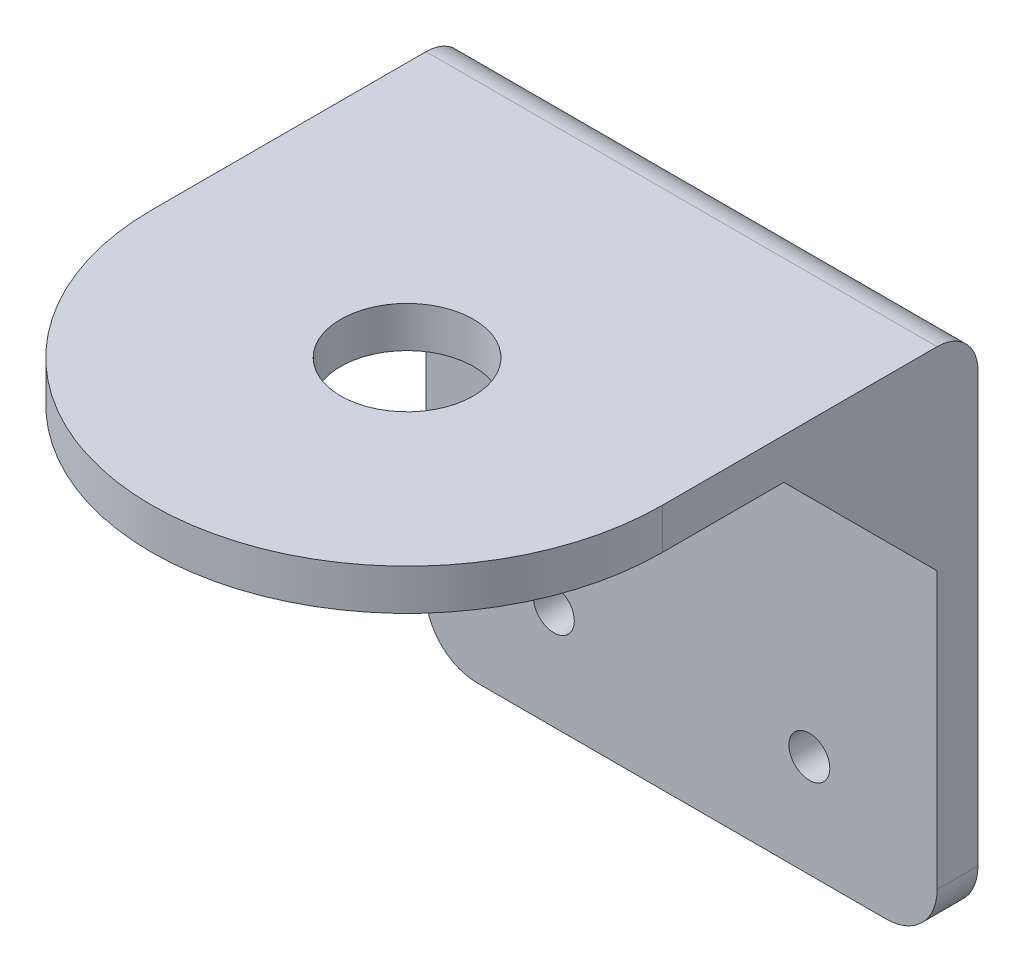
from build123d import *

# Parameters (mm, degrees)
SCHIZZO1_R                           = 6.5
SCHIZZO1_R_2                         = 2
BASE_FLANGIA1_DEPTH                  = 4
PIEGATURA_START                      = -26
PIEGATURA_DELLO_SCHIZZO1_OUTLINE_W   = 50
PIEGATURA_DELLO_SCHIZZO1_OUTLINE_H   = 4
PIEGATURA_DELLO_SCHIZZO1_DEPTH       = 52
PIEGATURA_START_2                    = -30
PIEGATURA_DELLO_SCHIZZO1_2_OUTLINE_R = 6.5
PIEGATURA_DELLO_SCHIZZO1_2_DEPTH     = 4
PIEGATURA_DELLO_SCHIZZO1_3_DEPTH     = 52
PIEGATURA_START_3                    = -25
PIEGATURA_DELLO_SCHIZZO1_4_DEPTH     = 50
ESTRUSIONE_ESTRUSIONE1_DEPTH         = 2


with BuildPart() as part:
    # Base-Flangia1: sheet metal written as solids
    # Schizzo1 → Base-Flangia1 (new body)
    with BuildSketch(Plane.XY):
        with BuildLine():
            Line((-25, -72), (-25, 0))
            ThreePointArc((-25, 0), (0, 25), (25, 0))
            Line((25, 0), (25, -72))
            ThreePointArc((25, -72), (23.535533906, -75.535533906), (20, -77))
            Line((20, -77), (-20, -77))
            ThreePointArc((-20, -77), (-23.535533906, -75.535533906), (-25, -72))
        make_face()
        Circle(SCHIZZO1_R, mode=Mode.SUBTRACT)
        with Locations((-12.5, -67)):
            Circle(SCHIZZO1_R_2, mode=Mode.SUBTRACT)
        with Locations((12.5, -67)):
            Circle(SCHIZZO1_R_2, mode=Mode.SUBTRACT)
    extrude(amount=-BASE_FLANGIA1_DEPTH)

    # Piegatura dello schizzo1: read off the stored shape, not the designer's step
    # Piegatura dello schizzo1 outline → Piegatura dello schizzo1 (cut)
    with BuildSketch(Plane(origin=(0, 0, 0), x_dir=(1, 0, 0), z_dir=(0, 1, 0)).offset(PIEGATURA_START)):
        with Locations((0, 2)):
            Rectangle(PIEGATURA_DELLO_SCHIZZO1_OUTLINE_W, PIEGATURA_DELLO_SCHIZZO1_OUTLINE_H)
    extrude(amount=PIEGATURA_DELLO_SCHIZZO1_DEPTH, mode=Mode.SUBTRACT)

    # Piegatura dello schizzo1 2 outline → Piegatura dello schizzo1 2 (add)
    with BuildSketch(Plane(origin=(0, 0, 0), x_dir=(1, 0, 0), z_dir=(0, 1, 0)).offset(PIEGATURA_START_2)):
        with BuildLine():
            Line((-25, 0), (-25, -26.862699383))
            ThreePointArc((-25, -26.862699383), (0, -51.862699383), (25, -26.862699383))
            Line((25, -26.862699383), (25, 0))
            Line((25, 0), (-25, 0))
        make_face()
        with Locations((0, -26.862699383)):
            Circle(PIEGATURA_DELLO_SCHIZZO1_2_OUTLINE_R, mode=Mode.SUBTRACT)
    extrude(amount=PIEGATURA_DELLO_SCHIZZO1_2_DEPTH)

    # Piegatura dello schizzo1 3 outline → Piegatura dello schizzo1 3 (cut)
    with BuildSketch(Plane.YZ.offset(PIEGATURA_START)):
        with BuildLine():
            ThreePointArc((-26, 0.01), (-27.174501807, -2.825498193), (-30.01, -4))
            Line((-30.01, -4), (-26, -4))
            Line((-26, -4), (-26, 0.01))
        make_face()
    extrude(amount=PIEGATURA_DELLO_SCHIZZO1_3_DEPTH, mode=Mode.SUBTRACT)

    # Piegatura dello schizzo1 4 outline → Piegatura dello schizzo1 4 (add)
    with BuildSketch(Plane.YZ.offset(PIEGATURA_START_3)):
        with BuildLine():
            ThreePointArc((-30, 0.01), (-30.002928932, 0.002928932), (-30.01, 0))
            Line((-30.01, 0), (-30, 0))
            Line((-30, 0), (-30, 0.01))
        make_face()
    extrude(amount=PIEGATURA_DELLO_SCHIZZO1_4_DEPTH)

    # Schizzo13 → Estrusione-Estrusione1 (add)
    with BuildSketch(Plane.ZY.offset(25)):
        with BuildLine():
            Line((0.01, -30), (15, -30))
            Line((15, -30), (0, -45))
            Line((0, -45), (0, -30.01))
            ThreePointArc((0, -30.01), (0.002928932, -30.002928932), (0.01, -30))
        make_face()
    estrusione_estrusione1 = extrude(amount=-ESTRUSIONE_ESTRUSIONE1_DEPTH)

    # Specchia1: Estrusione-Estrusione1 across plane
    add(estrusione_estrusione1.mirror(Plane(origin=(0, 0, 0), x_dir=(0, 0, 1), z_dir=(1, 0, 0))))


solid = part.part
